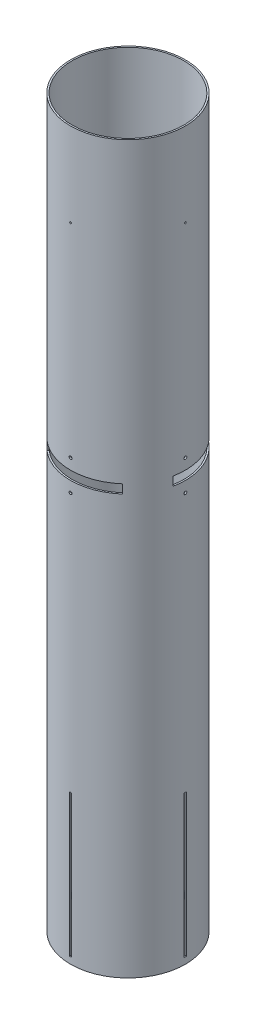
from build123d import *

# Parameters (mm, degrees)
SKETCH1_R                 = 78.359
SKETCH1_R_2               = 76.2
BOSS_EXTRUDE1_DEPTH       = 990.6
FIN_SLOTS_DEPTH           = 997.779125866
CIRPATTERN1_COUNT         = 4
CUT_EXTRUDE2_DEPTH        = 997.779125866
CIRPATTERN2_COUNT         = 4
SKETCH3_R                 = 3.175
CUT_EXTRUDE3_DEPTH        = 997.779125982
CUT_EXTRUDE4_START        = -12.065
CUT_EXTRUDE4_DEPTH        = 12.065
CIRPATTERN3_COUNT         = 3
SKETCH2_4_R               = 1.0922
SHEAR_SCREW_HOLES_DEPTH   = 997.779125982
SHEAR_SCREW_PATTERN_COUNT = 4
LPATTERN1_COUNT           = 2
LPATTERN1_PITCH           = 41.5239708
LPATTERN1_COPY_1_DEPTH    = 997.779125866
LPATTERN1_COPY_2_DEPTH    = 997.779125866
LPATTERN1_COPY_3_DEPTH    = 997.779125866


with BuildPart() as part:
    # Sketch1 → Boss-Extrude1 (new body)
    with BuildSketch(Plane(origin=(0, 0, 0), x_dir=(1, 0, 0), z_dir=(0, 1, 0))):
        Circle(SKETCH1_R)
        Circle(SKETCH1_R_2, mode=Mode.SUBTRACT)
    extrude(amount=BOSS_EXTRUDE1_DEPTH)

    # Sketch2 → Fin Slots (cut, through all)
    with BuildSketch(Plane(origin=(0, 0, 0), x_dir=(0, 0, -1), z_dir=(1, 0, 0))):
        Polygon((0, 8.89), (1.5875, 8.89), (1.5875, 203.2), (-1.5875, 203.2), (-1.5875, 8.89), align=None)
    fin_slots = extrude(amount=-FIN_SLOTS_DEPTH, mode=Mode.SUBTRACT)

    # CirPattern1: Fin Slots ×4 about axis
    cirpattern1_axis = Axis((0, 0, 0), (0, 1, 0))
    for i in range(1, CIRPATTERN1_COUNT):
        add(fin_slots.rotate(cirpattern1_axis, i * 360 / CIRPATTERN1_COUNT), mode=Mode.SUBTRACT)

    # Sketch2<3> → Cut-Extrude2 (cut, through all)
    with BuildSketch(Plane(origin=(0, 0, 0), x_dir=(0, 0, -1), z_dir=(1, 0, 0))):
        with BuildLine():
            ThreePointArc((1.999996, 598.6450054), (1.414210734, 600.059216134), (0, 600.6450014))
            ThreePointArc((0, 600.6450014), (-1.414210734, 597.230794666), (1.999996, 598.6450054))
        make_face()
    cut_extrude2 = extrude(amount=-CUT_EXTRUDE2_DEPTH, mode=Mode.SUBTRACT)

    # CirPattern2: Cut-Extrude2 ×4 about axis
    cirpattern2_axis = Axis((0, 990.6, 0), (0, -1, 0))
    for i in range(1, CIRPATTERN2_COUNT):
        add(cut_extrude2.rotate(cirpattern2_axis, i * 360 / CIRPATTERN2_COUNT), mode=Mode.SUBTRACT)

    # Sketch3 → Cut-Extrude3 (cut, through all)
    with BuildSketch(Plane(origin=(0, 0, 0), x_dir=(0.7071067811865477, 0, -0.7071067811865475), z_dir=(0.7071067811865475, 0, 0.7071067811865477))):
        with Locations((0, 127)):
            Circle(SKETCH3_R)
    extrude(amount=-CUT_EXTRUDE3_DEPTH, mode=Mode.SUBTRACT)

    # Sketch7 → Cut-Extrude4 (cut)
    with BuildSketch(Plane(origin=(0, 583.8825, 0), x_dir=(1, 0, 0), z_dir=(0, 1, 0)).offset(CUT_EXTRUDE4_START)):
        with BuildLine():
            Line((-76.853353787, -15.287082543), (-74.735838367, -14.865882538))
            ThreePointArc((-74.735838367, -14.865882538), (-65.991135768, 38.1), (-24.493687256, 72.156075868))
            Line((-24.493687256, 72.156075868), (-25.187675062, 74.200498017))
            ThreePointArc((-25.187675062, 74.200498017), (-63.106141662, 46.451563651), (-78.333472392, 1.999996))
            ThreePointArc((-78.333472392, 1.999996), (-78.359, 0), (-78.333472392, -1.999996))
            ThreePointArc((-78.333472392, -1.999996), (-77.877303639, -8.675163336), (-76.853353787, -15.287082543))
        make_face()
    cut_extrude4 = extrude(amount=CUT_EXTRUDE4_DEPTH, mode=Mode.SUBTRACT)

    # CirPattern3: Cut-Extrude4 ×3 about axis
    cirpattern3_axis = Axis((0, 990.6, 0), (0, -1, 0))
    for i in range(1, CIRPATTERN3_COUNT):
        add(cut_extrude4.rotate(cirpattern3_axis, i * 360 / CIRPATTERN3_COUNT), mode=Mode.SUBTRACT)

    # Sketch2<4> → Shear Screw Holes (cut, through all)
    with BuildSketch(Plane(origin=(0, 0, 0), x_dir=(0, 0, -1), z_dir=(1, 0, 0))):
        with Locations((0, 876.3)):
            Circle(SKETCH2_4_R)
    shear_screw_holes = extrude(amount=-SHEAR_SCREW_HOLES_DEPTH, mode=Mode.SUBTRACT)

    # Shear Screw Pattern: Shear Screw Holes ×4 about axis
    shear_screw_pattern_axis = Axis((0, 990.6, 0), (0, -1, 0))
    for i in range(1, SHEAR_SCREW_PATTERN_COUNT):
        add(shear_screw_holes.rotate(shear_screw_pattern_axis, i * 360 / SHEAR_SCREW_PATTERN_COUNT), mode=Mode.SUBTRACT)

    # LPattern1: Cut-Extrude2 ×2
    with Locations(*[(0, -i * LPATTERN1_PITCH, 0) for i in range(1, LPATTERN1_COUNT)]):
        add(cut_extrude2, mode=Mode.SUBTRACT)

    # LPattern1 copy 1 sketch → LPattern1 copy 1 (cut, through all)
    with BuildSketch(Plane(origin=(0, -41.5239708, 0), x_dir=(1, 0, 0), z_dir=(0, 0, 1))):
        with BuildLine():
            ThreePointArc((1.999996, 598.6450054), (1.414210734, 600.059216134), (0, 600.6450014))
            ThreePointArc((0, 600.6450014), (-1.414210734, 597.230794666), (1.999996, 598.6450054))
        make_face()
    extrude(amount=-LPATTERN1_COPY_1_DEPTH, mode=Mode.SUBTRACT)

    # LPattern1 copy 2 sketch → LPattern1 copy 2 (cut, through all)
    with BuildSketch(Plane(origin=(0, -41.5239708, 0), x_dir=(0, 0, 1), z_dir=(-1, 0, 0))):
        with BuildLine():
            ThreePointArc((1.999996, 598.6450054), (1.414210734, 600.059216134), (0, 600.6450014))
            ThreePointArc((0, 600.6450014), (-1.414210734, 597.230794666), (1.999996, 598.6450054))
        make_face()
    extrude(amount=-LPATTERN1_COPY_2_DEPTH, mode=Mode.SUBTRACT)

    # LPattern1 copy 3 sketch → LPattern1 copy 3 (cut, through all)
    with BuildSketch(Plane(origin=(0, -41.5239708, 0), x_dir=(-1, 0, 0), z_dir=(0, 0, -1))):
        with BuildLine():
            ThreePointArc((1.999996, 598.6450054), (1.414210734, 600.059216134), (0, 600.6450014))
            ThreePointArc((0, 600.6450014), (-1.414210734, 597.230794666), (1.999996, 598.6450054))
        make_face()
    extrude(amount=-LPATTERN1_COPY_3_DEPTH, mode=Mode.SUBTRACT)


solid = part.part
